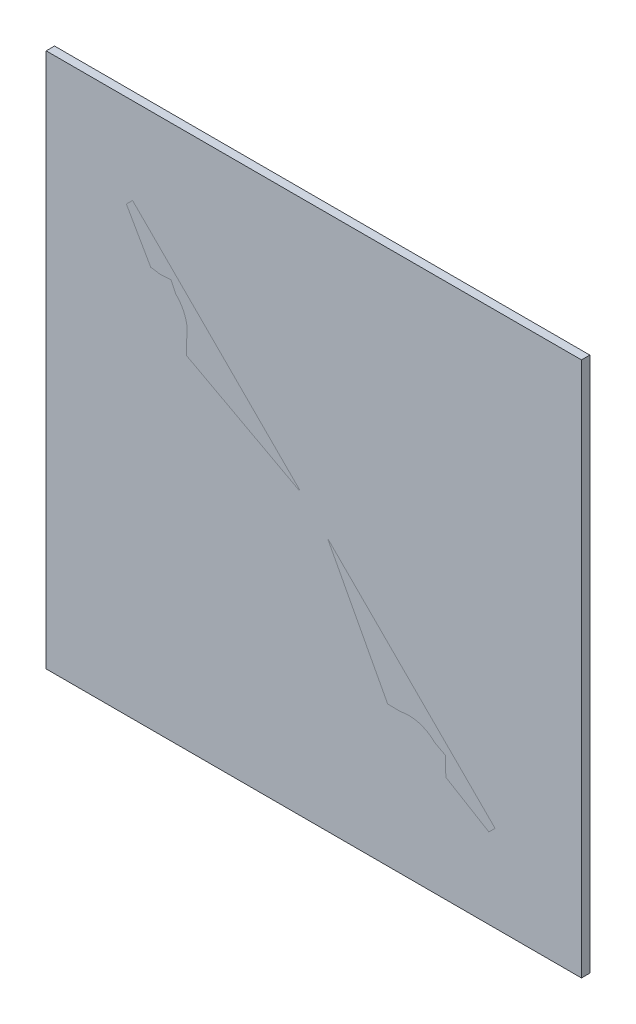
from build123d import *

# Parameters (mm, degrees)
SKETCH1_R                = 584.2
SKETCH1_R_2              = 85.725
SKETCH1_R_3              = 46.0375
SKETCH1_R_4              = 2.38125
BOSS_EXTRUDE1_DEPTH      = 19.05
CUT_EXTRUDE1_OUTLINE_W   = 41.254229691
CUT_EXTRUDE1_OUTLINE_H   = 205.000109937
CUT_EXTRUDE1_OUTLINE_W_2 = 98.758926402
CUT_EXTRUDE1_OUTLINE_H_2 = 54.392174278
CUT_EXTRUDE1_DEPTH       = 6.35
BOSS_EXTRUDE3_START      = 6.35
SKETCH5_R                = 60.325
SKETCH5_R_2              = 46.0375
BOSS_EXTRUDE3_DEPTH      = 6.35
CUT_EXTRUDE6_REACH       = 828.403
SKETCH11_R               = 2.38125
SKETCH12_W               = 1219.2
SKETCH12_H               = 1219.2
STOCK_DEPTH              = 19.05


# Read off the part's stored shape, not the designer's step: Cut-Extrude1
with BuildPart() as part:
    # Sketch1 → Boss-Extrude1 (new body)
    with BuildSketch(Plane.XY):
        with Locations(Location((0, 0, 0), (0, 0, 180))):
            Circle(SKETCH1_R)
        with Locations(Location((0, 431.8, 0), (0, 0, 180))):
            Circle(SKETCH1_R_2, mode=Mode.SUBTRACT)
        with Locations(Location((215.9, 373.949769354, 0), (0, 0, 180))):
            Circle(SKETCH1_R_2, mode=Mode.SUBTRACT)
        with Locations(Location((373.949769354, 215.9, 0), (0, 0, 180))):
            Circle(SKETCH1_R_2, mode=Mode.SUBTRACT)
        with Locations(Location((431.8, 0, 0), (0, 0, 180))):
            Circle(SKETCH1_R_2, mode=Mode.SUBTRACT)
        with Locations(Location((373.949769354, -215.9, 0), (0, 0, 180))):
            Circle(SKETCH1_R_2, mode=Mode.SUBTRACT)
        with Locations(Location((215.9, -373.949769354, 0), (0, 0, 180))):
            Circle(SKETCH1_R_2, mode=Mode.SUBTRACT)
        with Locations(Location((0, -431.8, 0), (0, 0, 180))):
            Circle(SKETCH1_R_2, mode=Mode.SUBTRACT)
        with Locations(Location((-215.9, -373.949769354, 0), (0, 0, 180))):
            Circle(SKETCH1_R_2, mode=Mode.SUBTRACT)
        with Locations(Location((-373.949769354, -215.9, 0), (0, 0, 180))):
            Circle(SKETCH1_R_2, mode=Mode.SUBTRACT)
        with Locations(Location((-431.8, 0, 0), (0, 0, 180))):
            Circle(SKETCH1_R_2, mode=Mode.SUBTRACT)
        with Locations(Location((-373.949769354, 215.9, 0), (0, 0, 180))):
            Circle(SKETCH1_R_2, mode=Mode.SUBTRACT)
        with Locations(Location((-215.9, 373.949769354, 0), (0, 0, 180))):
            Circle(SKETCH1_R_2, mode=Mode.SUBTRACT)
        with Locations(Location((0, 0, 0), (0, 0, 180))):
            Circle(SKETCH1_R_3, mode=Mode.SUBTRACT)
        with Locations(Location((0, 526.3, 0), (0, 0, 180))):
            Circle(SKETCH1_R_4, mode=Mode.SUBTRACT)
        with Locations(Location((94.5, 431.8, 0), (0, 0, 180))):
            Circle(SKETCH1_R_4, mode=Mode.SUBTRACT)
        with Locations(Location((0, 337.3, 0), (0, 0, 180))):
            Circle(SKETCH1_R_4, mode=Mode.SUBTRACT)
        with Locations(Location((-94.5, 431.8, 0), (0, 0, 180))):
            Circle(SKETCH1_R_4, mode=Mode.SUBTRACT)
        with Locations(Location((134.060599342, 421.199769354, 0), (0, 0, 180))):
            Circle(SKETCH1_R_4, mode=Mode.SUBTRACT)
        with Locations(Location((263.15, 455.789170012, 0), (0, 0, 180))):
            Circle(SKETCH1_R_4, mode=Mode.SUBTRACT)
        with Locations(Location((297.739400658, 326.699769354, 0), (0, 0, 180))):
            Circle(SKETCH1_R_4, mode=Mode.SUBTRACT)
        with Locations(Location((168.65, 292.110368696, 0), (0, 0, 180))):
            Circle(SKETCH1_R_4, mode=Mode.SUBTRACT)
        with Locations(Location((326.699769354, 297.739400658, 0), (0, 0, 180))):
            Circle(SKETCH1_R_4, mode=Mode.SUBTRACT)
        with Locations(Location((455.789170012, 263.15, 0), (0, 0, 180))):
            Circle(SKETCH1_R_4, mode=Mode.SUBTRACT)
        with Locations(Location((421.199769354, 134.060599342, 0), (0, 0, 180))):
            Circle(SKETCH1_R_4, mode=Mode.SUBTRACT)
        with Locations(Location((292.110368696, 168.65, 0), (0, 0, 180))):
            Circle(SKETCH1_R_4, mode=Mode.SUBTRACT)
        with Locations(Location((431.8, 94.5, 0), (0, 0, 180))):
            Circle(SKETCH1_R_4, mode=Mode.SUBTRACT)
        with Locations(Location((526.3, 0, 0), (0, 0, 180))):
            Circle(SKETCH1_R_4, mode=Mode.SUBTRACT)
        with Locations(Location((431.8, -94.5, 0), (0, 0, 180))):
            Circle(SKETCH1_R_4, mode=Mode.SUBTRACT)
        with Locations(Location((337.3, 0, 0), (0, 0, 180))):
            Circle(SKETCH1_R_4, mode=Mode.SUBTRACT)
        with Locations(Location((421.199769354, -134.060599342, 0), (0, 0, 180))):
            Circle(SKETCH1_R_4, mode=Mode.SUBTRACT)
        with Locations(Location((455.789170012, -263.15, 0), (0, 0, 180))):
            Circle(SKETCH1_R_4, mode=Mode.SUBTRACT)
        with Locations(Location((326.699769354, -297.739400658, 0), (0, 0, 180))):
            Circle(SKETCH1_R_4, mode=Mode.SUBTRACT)
        with Locations(Location((292.110368696, -168.65, 0), (0, 0, 180))):
            Circle(SKETCH1_R_4, mode=Mode.SUBTRACT)
        with Locations(Location((297.739400658, -326.699769354, 0), (0, 0, 180))):
            Circle(SKETCH1_R_4, mode=Mode.SUBTRACT)
        with Locations(Location((263.15, -455.789170012, 0), (0, 0, 180))):
            Circle(SKETCH1_R_4, mode=Mode.SUBTRACT)
        with Locations(Location((134.060599342, -421.199769354, 0), (0, 0, 180))):
            Circle(SKETCH1_R_4, mode=Mode.SUBTRACT)
        with Locations(Location((168.65, -292.110368696, 0), (0, 0, 180))):
            Circle(SKETCH1_R_4, mode=Mode.SUBTRACT)
        with Locations(Location((94.5, -431.8, 0), (0, 0, 180))):
            Circle(SKETCH1_R_4, mode=Mode.SUBTRACT)
        with Locations(Location((0, -526.3, 0), (0, 0, 180))):
            Circle(SKETCH1_R_4, mode=Mode.SUBTRACT)
        with Locations(Location((-94.5, -431.8, 0), (0, 0, 180))):
            Circle(SKETCH1_R_4, mode=Mode.SUBTRACT)
        with Locations(Location((0, -337.3, 0), (0, 0, 180))):
            Circle(SKETCH1_R_4, mode=Mode.SUBTRACT)
        with Locations(Location((-134.060599342, -421.199769354, 0), (0, 0, 180))):
            Circle(SKETCH1_R_4, mode=Mode.SUBTRACT)
        with Locations(Location((-263.15, -455.789170012, 0), (0, 0, 180))):
            Circle(SKETCH1_R_4, mode=Mode.SUBTRACT)
        with Locations(Location((-297.739400658, -326.699769354, 0), (0, 0, 180))):
            Circle(SKETCH1_R_4, mode=Mode.SUBTRACT)
        with Locations(Location((-168.65, -292.110368696, 0), (0, 0, 180))):
            Circle(SKETCH1_R_4, mode=Mode.SUBTRACT)
        with Locations(Location((-326.699769354, -297.739400658, 0), (0, 0, 180))):
            Circle(SKETCH1_R_4, mode=Mode.SUBTRACT)
        with Locations(Location((-455.789170012, -263.15, 0), (0, 0, 180))):
            Circle(SKETCH1_R_4, mode=Mode.SUBTRACT)
        with Locations(Location((-421.199769354, -134.060599342, 0), (0, 0, 180))):
            Circle(SKETCH1_R_4, mode=Mode.SUBTRACT)
        with Locations(Location((-292.110368696, -168.65, 0), (0, 0, 180))):
            Circle(SKETCH1_R_4, mode=Mode.SUBTRACT)
        with Locations(Location((-431.8, -94.5, 0), (0, 0, 180))):
            Circle(SKETCH1_R_4, mode=Mode.SUBTRACT)
        with Locations(Location((-526.3, 0, 0), (0, 0, 180))):
            Circle(SKETCH1_R_4, mode=Mode.SUBTRACT)
        with Locations(Location((-431.8, 94.5, 0), (0, 0, 180))):
            Circle(SKETCH1_R_4, mode=Mode.SUBTRACT)
        with Locations(Location((-337.3, 0, 0), (0, 0, 180))):
            Circle(SKETCH1_R_4, mode=Mode.SUBTRACT)
        with Locations(Location((-421.199769354, 134.060599342, 0), (0, 0, 180))):
            Circle(SKETCH1_R_4, mode=Mode.SUBTRACT)
        with Locations(Location((-455.789170012, 263.15, 0), (0, 0, 180))):
            Circle(SKETCH1_R_4, mode=Mode.SUBTRACT)
        with Locations(Location((-326.699769354, 297.739400658, 0), (0, 0, 180))):
            Circle(SKETCH1_R_4, mode=Mode.SUBTRACT)
        with Locations(Location((-292.110368696, 168.65, 0), (0, 0, 180))):
            Circle(SKETCH1_R_4, mode=Mode.SUBTRACT)
        with Locations(Location((-297.739400658, 326.699769354, 0), (0, 0, 180))):
            Circle(SKETCH1_R_4, mode=Mode.SUBTRACT)
        with Locations(Location((-263.15, 455.789170012, 0), (0, 0, 180))):
            Circle(SKETCH1_R_4, mode=Mode.SUBTRACT)
        with Locations(Location((-134.060599342, 421.199769354, 0), (0, 0, 180))):
            Circle(SKETCH1_R_4, mode=Mode.SUBTRACT)
        with Locations(Location((-168.65, 292.110368696, 0), (0, 0, 180))):
            Circle(SKETCH1_R_4, mode=Mode.SUBTRACT)
    extrude(amount=BOSS_EXTRUDE1_DEPTH)

    # Cut-Extrude1 outline → Cut-Extrude1 (cut)
    with BuildSketch(Plane.XY):
        with BuildLine():
            Line((-82.33542317, -158.557607133), (-37.731752188, -158.567410842))
            Line((-37.731752188, -158.567410842), (-37.70270647, -26.418882094))
            ThreePointArc((-37.70270647, -26.418882094), (-46.037498888, 0.010118858), (-37.691089298, 26.435453349))
            Line((-37.691089298, 26.435453349), (-37.686693984, 46.432694143))
            Line((-37.686693984, 46.432694143), (-82.290364966, 46.442497851))
            Line((-82.290364966, 46.442497851), (-82.33542317, -158.557607133))
        make_face()
        with BuildLine():
            ThreePointArc((23.362161365, -39.669394029), (0.024085325, -46.0374937), (-23.320641105, -39.693816958))
            Line((-23.320641105, -39.693816958), (-23.346769741, -158.570572604))
            Line((-23.346769741, -158.570572604), (23.362161365, -158.575705822))
            Line((23.362161365, -158.575705822), (23.362161365, -39.669394029))
        make_face()
        with BuildLine():
            Line((-23.301711537, 46.429532381), (-23.303189768, 39.70406469))
            ThreePointArc((-23.303189768, 39.70406469), (0.034204181, 46.037487294), (23.362161365, 39.669394029))
            Line((23.362161365, 39.669394029), (23.362161365, 46.424404115))
            Line((23.362161365, 46.424404115), (-23.301711537, 46.429532381))
        make_face()
        with BuildLine():
            ThreePointArc((37.74714416, 26.355350766), (46.0375, 0), (37.74714416, -26.355350766))
            Line((37.74714416, -26.355350766), (37.74714416, -158.575705822))
            Line((37.74714416, -158.575705822), (82.350816219, -158.575705822))
            Line((82.350816219, -158.575705822), (82.350816219, 46.424404115))
            Line((82.350816219, 46.424404115), (37.74714416, 46.424404115))
            Line((37.74714416, 46.424404115), (37.74714416, 26.355350766))
        make_face()
        Polygon((-138.520786843, 46.454857074), (-138.565845047, -158.545247911), (-97.311616353, -158.554315426), (-97.266558149, 46.445789559), align=None)
        Polygon((-252.146315037, 46.479831511), (-252.191373241, -158.520273474), (-153.432449225, -158.541980291), (-153.387391021, 46.458124694), align=None)
        with Locations((117.954124609, -56.075650854)):
            Rectangle(CUT_EXTRUDE1_OUTLINE_W, CUT_EXTRUDE1_OUTLINE_H)
        with Locations((202.827307192, -56.075650854)):
            Rectangle(CUT_EXTRUDE1_OUTLINE_W_2, CUT_EXTRUDE1_OUTLINE_H)
        Polygon((-138.581236107, -228.569540398), (138.581239454, -228.6), (138.581239454, -174.207825722), (-138.569280924, -174.177367434), align=None)
        Polygon((120.03556483, 61.170723971), (0.040086024, 136.156625786), (-119.971871485, 61.197100308), align=None)
        Polygon((147.788771841, 61.170723971), (252.206770393, 61.170723971), (252.206770393, 137.604129426), (22.430839551, 137.604129426), align=None)
        with Locations((202.827307192, -201.403912861)):
            Rectangle(CUT_EXTRUDE1_OUTLINE_W_2, CUT_EXTRUDE1_OUTLINE_H_2)
        with BuildLine():
            ThreePointArc((0.056205994, 282.837814852), (-127.339765805, 247.703277883), (-218.674381844, 152.1932929))
            Line((-218.674381844, 152.1932929), (218.758073404, 152.145219948))
            ThreePointArc((218.758073404, 152.145219948), (127.444452284, 247.675277607), (0.056205994, 282.837814852))
        make_face()
        Polygon((-252.126274098, 137.659554619), (-252.143073855, 61.22615101), (-147.725077825, 61.203200352), (-22.350348806, 137.609050789), align=None)
        Polygon((-153.435885102, -174.174099813), (-252.194809119, -174.152392996), (-252.206764301, -228.544565961), (-153.447840285, -228.566272778), align=None)
    extrude(amount=CUT_EXTRUDE1_DEPTH, mode=Mode.SUBTRACT)

    # Sketch5 → Boss-Extrude3 (add)
    with BuildSketch(Plane(origin=(0, 0, 6.35), x_dir=(-1, 0, 0), z_dir=(0, 0, -1)).offset(BOSS_EXTRUDE3_START)):
        Circle(SKETCH5_R)
        Circle(SKETCH5_R_2, mode=Mode.SUBTRACT)
    extrude(amount=-BOSS_EXTRUDE3_DEPTH)

    # Sketch11 → Cut-Extrude6 (cut, up to next)
    with BuildSketch(Plane(origin=(0, 0, 0), x_dir=(-1, 0, 0), z_dir=(0, 0, -1)), mode=Mode.PRIVATE) as cut_extrude6_sk1:
        with Locations((0, 54.25)):
            Circle(SKETCH11_R)
    cut_extrude6_tool1 = extrude(cut_extrude6_sk1.sketch, amount=-CUT_EXTRUDE6_REACH, mode=Mode.PRIVATE) & part.part
    # Sketch11 → Cut-Extrude6 (cut, up to next)
    with BuildSketch(Plane(origin=(0, 0, 0), x_dir=(-1, 0, 0), z_dir=(0, 0, -1)), mode=Mode.PRIVATE) as cut_extrude6_sk2:
        with Locations((54.25, 0)):
            Circle(SKETCH11_R)
    cut_extrude6_tool2 = extrude(cut_extrude6_sk2.sketch, amount=-CUT_EXTRUDE6_REACH, mode=Mode.PRIVATE) & part.part
    # Sketch11 → Cut-Extrude6 (cut, up to next)
    with BuildSketch(Plane(origin=(0, 0, 0), x_dir=(-1, 0, 0), z_dir=(0, 0, -1)), mode=Mode.PRIVATE) as cut_extrude6_sk3:
        with Locations((0, -54.25)):
            Circle(SKETCH11_R)
    cut_extrude6_tool3 = extrude(cut_extrude6_sk3.sketch, amount=-CUT_EXTRUDE6_REACH, mode=Mode.PRIVATE) & part.part
    # Sketch11 → Cut-Extrude6 (cut, up to next)
    with BuildSketch(Plane(origin=(0, 0, 0), x_dir=(-1, 0, 0), z_dir=(0, 0, -1)), mode=Mode.PRIVATE) as cut_extrude6_sk4:
        with Locations((-54.25, 0)):
            Circle(SKETCH11_R)
    cut_extrude6_tool4 = extrude(cut_extrude6_sk4.sketch, amount=-CUT_EXTRUDE6_REACH, mode=Mode.PRIVATE) & part.part
    add(cut_extrude6_tool1.solids().sort_by_distance((0, 54.25, 0))[0], mode=Mode.SUBTRACT)
    add(cut_extrude6_tool2.solids().sort_by_distance((-54.25, 0, 0))[0], mode=Mode.SUBTRACT)
    add(cut_extrude6_tool3.solids().sort_by_distance((0, -54.25, 0))[0], mode=Mode.SUBTRACT)
    add(cut_extrude6_tool4.solids().sort_by_distance((54.25, 0, 0))[0], mode=Mode.SUBTRACT)


with BuildPart() as body_2:
    # Sketch12 → Stock (new body)
    with BuildSketch(Plane(origin=(0, 0, 0), x_dir=(-1, 0, 0), z_dir=(0, 0, -1))):
        Rectangle(SKETCH12_W, SKETCH12_H)
    extrude(amount=-STOCK_DEPTH)


solid = Compound([part.part, body_2.part])
